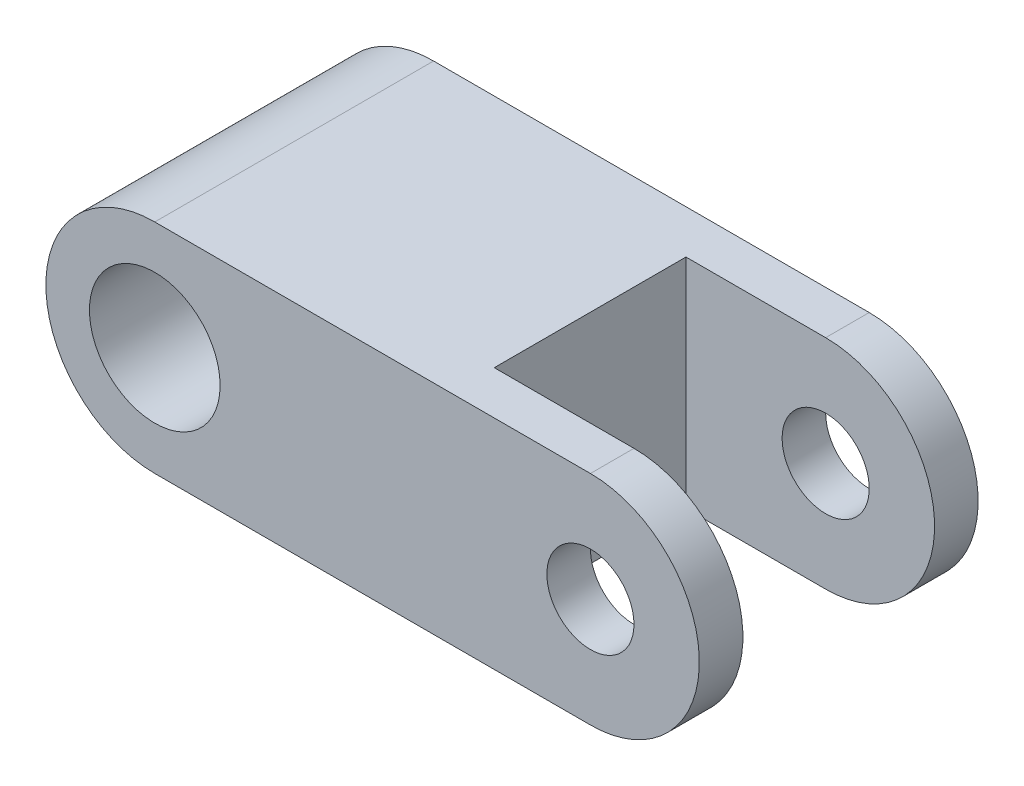
from build123d import *

# Parameters (mm, degrees)
SKETCH1_R           = 7.5
SKETCH1_R_2         = 5
BOSS_EXTRUDE1_DEPTH = 32
CUT_EXTRUDE1_REACH  = 76.534
SKETCH2_W           = 28.533543241
SKETCH2_H           = 22


with BuildPart() as part:
    # Sketch1 → Boss-Extrude1 (new body)
    with BuildSketch(Plane.XY):
        with BuildLine():
            Line((0, 12.5), (50, 12.5))
            ThreePointArc((50, 12.5), (62.5, 0), (50, -12.5))
            Line((50, -12.5), (0, -12.5))
            ThreePointArc((0, -12.5), (-12.5, 0), (0, 12.5))
        make_face()
        Circle(SKETCH1_R, mode=Mode.SUBTRACT)
        with Locations((50, 0)):
            Circle(SKETCH1_R_2, mode=Mode.SUBTRACT)
    extrude(amount=BOSS_EXTRUDE1_DEPTH)

    # Sketch2 → Cut-Extrude1 (cut, up to next)
    with BuildSketch(Plane(origin=(0, 12.5, 0), x_dir=(1, 0, 0), z_dir=(0, 1, 0)), mode=Mode.PRIVATE) as cut_extrude1_sk1:
        with Locations((48.23322838, -16)):
            Rectangle(SKETCH2_W, SKETCH2_H)
    cut_extrude1_tool1 = extrude(cut_extrude1_sk1.sketch, amount=-CUT_EXTRUDE1_REACH, mode=Mode.PRIVATE) & part.part
    add(cut_extrude1_tool1.solids().sort_by_distance((48.233228, 12.5, 16))[0], mode=Mode.SUBTRACT)


solid = part.part
